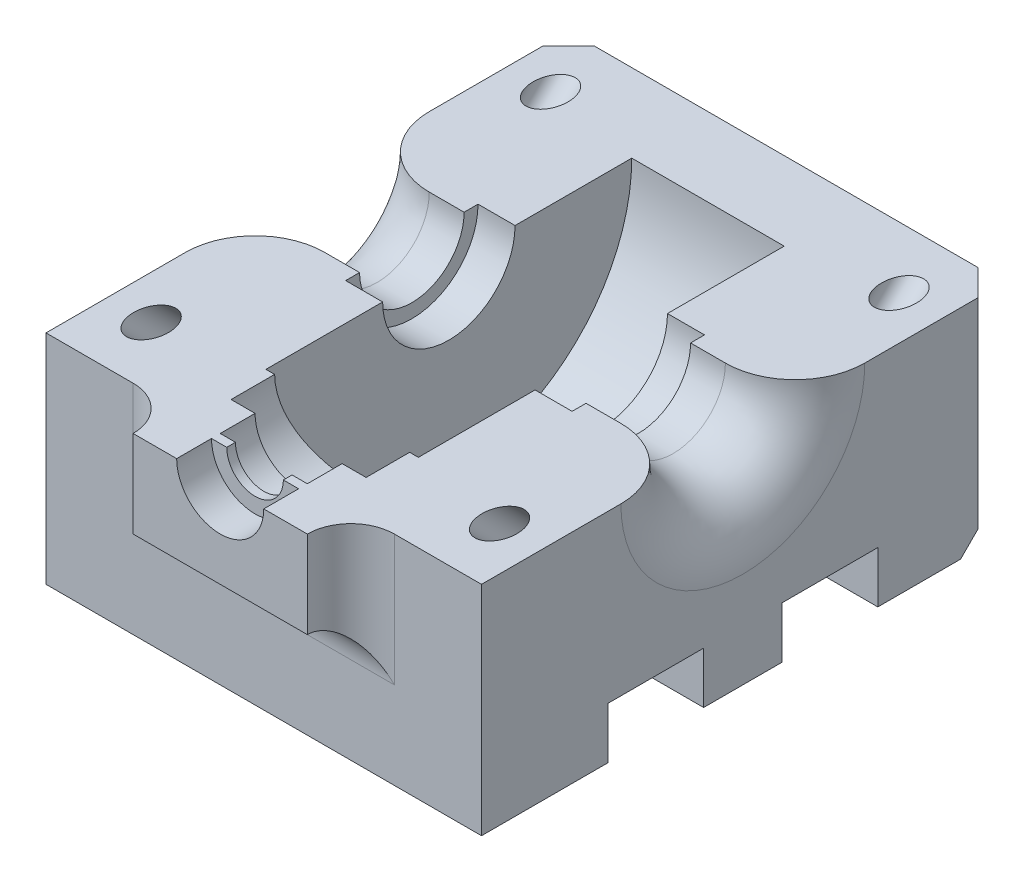
from build123d import *

# Parameters (mm, degrees)
SKETCH1_W                = 50
SKETCH1_H                = 60
BOSS_EXTRUDE1_DEPTH      = 25
CUT_EXTRUDE1_START       = -16.25
SKETCH2_R                = 21
CUT_EXTRUDE1_DEPTH       = 17.5
CUT_EXTRUDE2_START       = -12
SKETCH3_R                = 7.6
CUT_EXTRUDE2_DEPTH       = 26
SKETCH4_R                = 5
CUT_EXTRUDE3_DEPTH       = 4
SKETCH5_R                = 1.75
CUT_EXTRUDE4_DEPTH       = 10
CHAMFER1_SIZE            = 5
SKETCH6_R                = 2
CUT_EXTRUDE5_DEPTH       = 10
SKETCH7_W                = 11
SKETCH7_H                = 5.906734889
CUT_EXTRUDE6_DEPTH       = 9
CHAMFER2_SIZE            = 5
CHAMFER2_OF_MIRROR1_SIZE = 5
CHAMFER3_SIZE            = 3
CUT_EXTRUDE8_START       = 25
SKETCH10_R               = 2
CUT_EXTRUDE8_DEPTH       = 25.371044145
CUT_EXTRUDE10_DEPTH      = 64.442887702
CUT_EXTRUDE10_DEPTH_BACK = 64.442887702
SKETCH12_R               = 6
FILLET1_R                = 8
SKETCH16_R               = 7.75
CUT_EXTRUDE13_DEPTH      = 8
SKETCH17_W               = 20
SKETCH17_H               = 10
BOSS_EXTRUDE2_DEPTH      = 5
SKETCH18_R               = 3.25
CUT_EXTRUDE14_DEPTH      = 10
SKETCH19_R               = 5
CUT_EXTRUDE15_DEPTH      = 4
FILLET2_R                = 5


with BuildPart() as part:
    # Sketch1 → Boss-Extrude1 (new body)
    with BuildSketch(Plane(origin=(0, 0, 0), x_dir=(1, 0, 0), z_dir=(0, 1, 0))):
        Rectangle(SKETCH1_W, SKETCH1_H)
    extrude(amount=BOSS_EXTRUDE1_DEPTH)

    # Sketch2 → Cut-Extrude1 (cut)
    with BuildSketch(Plane.ZY.offset(25).offset(CUT_EXTRUDE1_START)):
        with Locations((0, 25)):
            Circle(SKETCH2_R)
    extrude(amount=-CUT_EXTRUDE1_DEPTH, mode=Mode.SUBTRACT)

    # Sketch3 → Cut-Extrude2 (cut)
    with BuildSketch(Plane.ZY.offset(25).offset(CUT_EXTRUDE2_START)):
        with Locations((0, 25)):
            Circle(SKETCH3_R)
    extrude(amount=-CUT_EXTRUDE2_DEPTH, mode=Mode.SUBTRACT)

    # Sketch4 → Cut-Extrude3 (cut)
    with BuildSketch(Plane.XY.offset(30)):
        with Locations((0, 25)):
            Circle(SKETCH4_R)
    extrude(amount=-CUT_EXTRUDE3_DEPTH, mode=Mode.SUBTRACT)

    # Sketch5 → Cut-Extrude4 (cut)
    with BuildSketch(Plane.XZ):
        with Locations(Location((-10, 20, 0), (0, 0, 270))):
            Circle(SKETCH5_R)
        with Locations(Location((10, 20, 0), (0, 0, 270))):
            Circle(SKETCH5_R)
        with Locations(Location((-10, -20, 0), (0, 0, 270))):
            Circle(SKETCH5_R)
        with Locations(Location((10, -20, 0), (0, 0, 270))):
            Circle(SKETCH5_R)
    extrude(amount=-CUT_EXTRUDE4_DEPTH, mode=Mode.SUBTRACT)

    # Chamfer1
    chamfer1_edges = [part.edges().sort_by_distance(p)[0] for p in [
        (0, 0, -30),
    ]]
    chamfer(chamfer1_edges, length=CHAMFER1_SIZE)

    # Sketch6 → Cut-Extrude5 (cut)
    with BuildSketch(Plane(origin=(0, 0, -30), x_dir=(-1, 0, 0), z_dir=(0, 0, -1))):
        with Locations((-20, 15)):
            Circle(SKETCH6_R)
        with Locations((20, 15)):
            Circle(SKETCH6_R)
    extrude(amount=-CUT_EXTRUDE5_DEPTH, mode=Mode.SUBTRACT)

    # Sketch7 → Cut-Extrude6 (cut)
    with BuildSketch(Plane(origin=(25, 0, 0), x_dir=(0, 0, -1), z_dir=(1, 0, 0))):
        with Locations((-10, 2.953367444)):
            Rectangle(SKETCH7_W, SKETCH7_H)
        with Locations((10, 2.953367444)):
            Rectangle(SKETCH7_W, SKETCH7_H)
    cut_extrude6 = extrude(amount=-CUT_EXTRUDE6_DEPTH, mode=Mode.SUBTRACT)

    # Chamfer2
    chamfer2_edges = [part.edges().sort_by_distance(p)[0] for p in [
        (16, 5.906734889, 10),
        (16, 5.906734889, -10),
    ]]
    chamfer(chamfer2_edges, length=CHAMFER2_SIZE)

    # Mirror1: Cut-Extrude6 across plane
    add(cut_extrude6.mirror(Plane(origin=(0, 0, 0), x_dir=(0, 0, 1), z_dir=(1, 0, 0))), mode=Mode.SUBTRACT)

    # Chamfer2 of Mirror1
    chamfer2_of_mirror1_edges = [part.edges().sort_by_distance(p)[0] for p in [
        (-16, 5.906734889, 10),
        (-16, 5.906734889, -10),
    ]]
    chamfer(chamfer2_of_mirror1_edges, length=CHAMFER2_OF_MIRROR1_SIZE)

    # Chamfer3
    chamfer3_edges = [part.edges().sort_by_distance(p)[0] for p in [
        (-25, 15, -30),
        (25, 15, -30),
    ]]
    chamfer(chamfer3_edges, length=CHAMFER3_SIZE - 0.0001)  # a hair under: the kernel refuses the full size

    # Sketch10 → Cut-Extrude8 (cut, through all)
    with BuildSketch(Plane(origin=(0, -2.5, -2.5), x_dir=(1, 0, 0), z_dir=(0, 0.7071067811865475, 0.7071067811865477)).offset(CUT_EXTRUDE8_START)):
        with Locations(Location((-20, 1.464466094, 0), (0, 0, 90))):
            Circle(SKETCH10_R)
        with Locations(Location((20, 1.464466094, 0), (0, 0, 90))):
            Circle(SKETCH10_R)
    cut_extrude8 = extrude(amount=CUT_EXTRUDE8_DEPTH, mode=Mode.SUBTRACT)

    # Mirror2: Cut-Extrude8 across plane
    add(cut_extrude8.mirror(Plane.XY), mode=Mode.SUBTRACT)

    # Sketch12 → Cut-Extrude10 (cut, two sides: drawn at the far end of the back side and taken through both)
    with BuildSketch(Plane.ZY.offset(25).offset(-CUT_EXTRUDE10_DEPTH_BACK)):
        with Locations((0, 25)):
            Circle(SKETCH12_R)
    extrude(amount=CUT_EXTRUDE10_DEPTH + CUT_EXTRUDE10_DEPTH_BACK, mode=Mode.SUBTRACT)

    # Fillet1
    fillet1_edges = [part.edges().sort_by_distance(p)[0] for p in [
        (25, 19, 0),
        (-25, 19, 0),
    ]]
    fillet(fillet1_edges, radius=FILLET1_R)

    # Sketch16 → Cut-Extrude13 (cut)
    with BuildSketch(Plane.XY.offset(26)):
        with Locations((0, 25)):
            Circle(SKETCH16_R)
    extrude(amount=-CUT_EXTRUDE13_DEPTH, mode=Mode.SUBTRACT)

    # Sketch17 → Boss-Extrude2 (add)
    with BuildSketch(Plane.XY.offset(30)):
        with Locations((0, 20)):
            Rectangle(SKETCH17_W, SKETCH17_H)
    extrude(amount=BOSS_EXTRUDE2_DEPTH)

    # Sketch18 → Cut-Extrude14 (cut)
    with BuildSketch(Plane(origin=(0, 0, 30), x_dir=(-1, 0, 0), z_dir=(0, 0, -1))):
        with Locations((0, 25)):
            Circle(SKETCH18_R)
    extrude(amount=-CUT_EXTRUDE14_DEPTH, mode=Mode.SUBTRACT)

    # Sketch19 → Cut-Extrude15 (cut)
    with BuildSketch(Plane.XY.offset(35)):
        with Locations((0, 25)):
            Circle(SKETCH19_R)
    extrude(amount=-CUT_EXTRUDE15_DEPTH, mode=Mode.SUBTRACT)

    # Fillet2
    fillet2_edges = [part.edges().sort_by_distance(p)[0] for p in [
        (-10, 20, 30),
        (0, 15, 30),
        (10, 20, 30),
    ]]
    fillet(fillet2_edges, radius=FILLET2_R - 0.0001)  # a hair under: the kernel refuses the full size


solid = part.part
